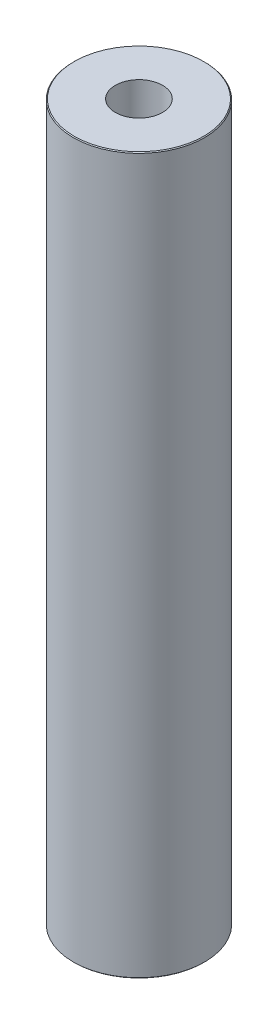
from build123d import *

# Parameters (mm, degrees)
SKETCH1_R           = 55
BOSS_EXTRUDE1_DEPTH = 600
SKETCH2_R           = 19.772926173
CUT_EXTRUDE1_DEPTH  = 606.020660804
CHAMFER1_SIZE       = 0.70104097


with BuildPart() as part:
    # Sketch1 → Boss-Extrude1 (new body)
    with BuildSketch(Plane(origin=(0, 0, 0), x_dir=(1, 0, 0), z_dir=(0, 1, 0))):
        Circle(SKETCH1_R)
    extrude(amount=BOSS_EXTRUDE1_DEPTH)

    # Sketch2 → Cut-Extrude1 (cut, through all)
    with BuildSketch(Plane(origin=(0, 0, 0), x_dir=(1, 0, 0), z_dir=(0, 1, 0))):
        Circle(SKETCH2_R)
    extrude(amount=CUT_EXTRUDE1_DEPTH, mode=Mode.SUBTRACT)

    # Chamfer1
    chamfer1_edges = [part.edges().sort_by_distance(p)[0] for p in [
        (-55, 600, 0),
        (-55, 0, 0),
    ]]
    chamfer(chamfer1_edges, length=CHAMFER1_SIZE)


solid = part.part
